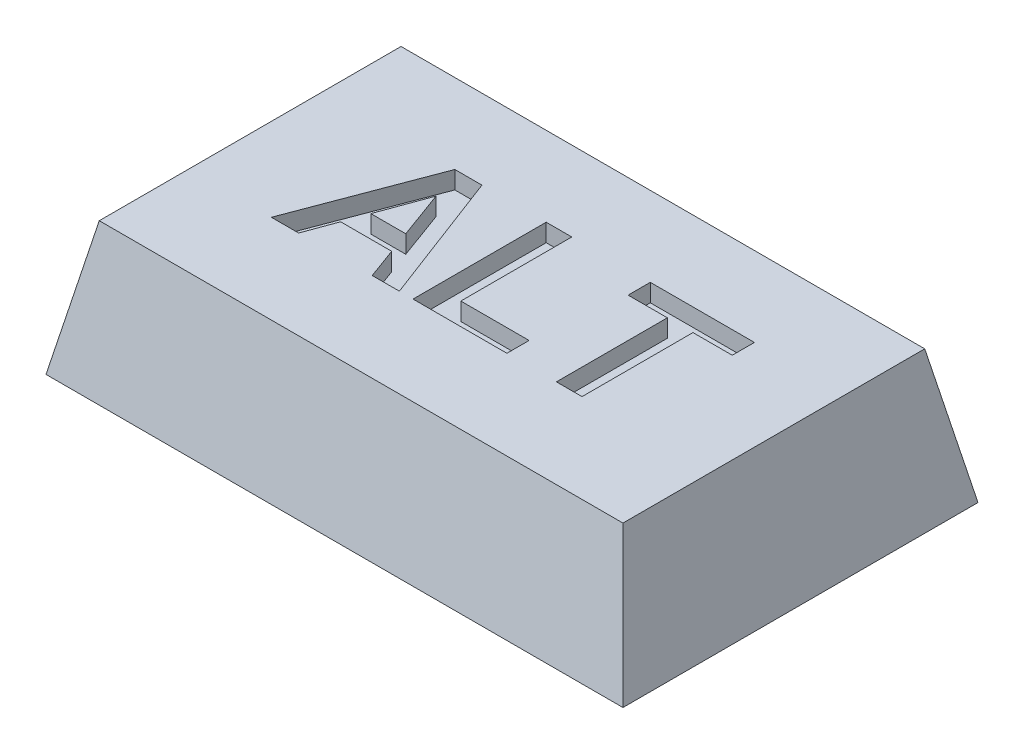
from build123d import *

# Parameters (mm, degrees)
SKETCH1_W               = 13
SKETCH1_H               = 8
BOSS_EXTRUDE1_DEPTH     = 3
CUT_EXTRUDE1_DEPTH      = 16.556349186
CUT_EXTRUDE1_DEPTH_BACK = 16.556349186
CUT_EXTRUDE2_DEPTH      = 16.556349186
CUT_EXTRUDE2_DEPTH_BACK = 16.556349186
SKETCH4_R               = 1.8
CUT_EXTRUDE3_DEPTH      = 0.8
SKETCH5_W               = 8
SKETCH5_H               = 1.1
BOSS_EXTRUDE2_DEPTH     = 2
FILLET1_R               = 4
CUT_EXTRUDE4_DEPTH      = 0.4


with BuildPart() as part:
    # Sketch1 → Boss-Extrude1 (new body)
    with BuildSketch(Plane(origin=(0, 0, 0), x_dir=(1, 0, 0), z_dir=(0, 1, 0))):
        with Locations((6.5, 4)):
            Rectangle(SKETCH1_W, SKETCH1_H)
    extrude(amount=BOSS_EXTRUDE1_DEPTH)

    # Sketch2 → Cut-Extrude1 (cut, two sides: drawn at the far end of the back side and taken through both)
    with BuildSketch(Plane.XY.offset(-CUT_EXTRUDE1_DEPTH_BACK)):
        Polygon((0, 0), (0.6, 3), (0, 3), align=None)
        Polygon((13, 0), (12.4, 3), (13, 3), align=None)
    extrude(amount=CUT_EXTRUDE1_DEPTH + CUT_EXTRUDE1_DEPTH_BACK, mode=Mode.SUBTRACT)

    # Sketch3 → Cut-Extrude2 (cut, two sides: drawn at the far end of the back side and taken through both)
    with BuildSketch(Plane(origin=(0, 0, 0), x_dir=(0, 0, -1), z_dir=(1, 0, 0)).offset(-CUT_EXTRUDE2_DEPTH_BACK)):
        Polygon((0, 0), (0.6, 3), (0, 3), align=None)
        Polygon((8, 3), (7.4, 3), (8, 0), align=None)
    extrude(amount=CUT_EXTRUDE2_DEPTH + CUT_EXTRUDE2_DEPTH_BACK, mode=Mode.SUBTRACT)

    # Sketch4 → Cut-Extrude3 (cut)
    with BuildSketch(Plane.XZ):
        with Locations(Location((6.50000125, -3.75, 0), (0, 0, 270))):
            Circle(SKETCH4_R)
    extrude(amount=-CUT_EXTRUDE3_DEPTH, mode=Mode.SUBTRACT)

    # Sketch5 → Boss-Extrude2 (add)
    with BuildSketch(Plane.XZ):
        with Locations((6.500011, -7.45)):
            Rectangle(SKETCH5_W, SKETCH5_H)
    extrude(amount=BOSS_EXTRUDE2_DEPTH)

    # Fillet1
    # the kernel refuses this fillet: 4 mm, written as the material it takes off along each edge
    with BuildSketch(Plane(origin=(10.500011, -2, -16.660254038), x_dir=(0, 1, 0), z_dir=(0, 0, 1)), Plane(origin=(2.500011, -2, 1.760254038), x_dir=(0, 1, 0), z_dir=(0, 0, -1))) as fillet1_piece_1:
        with BuildLine():
            CenterArc((4, 3.464101615), FILLET1_R, 180, 60)
            Line((0, 3.464101615), (-0.08, 3.464101615))
            Line((-0.08, 3.464101615), (-0.08, 0))
            Line((-0.08, 0), (0, -0.08))
            ThreePointArc((0, -0.08), (1, -0.08), (1.96, -0.069282032))
            Line((1.96, -0.069282032), (2, 0))
        make_face()
    extrude(amount=18.420508076, mode=Mode.SUBTRACT)

    # Sketch6 → Cut-Extrude4 (cut)
    # profile 1 of 3: a face of its own
    with BuildSketch(Plane(origin=(0, 3, 0), x_dir=(1, 0, 0), z_dir=(0, 1, 0))):
        Polygon((5.356583629, 2.605681315), (4.744804782, 2.605681315), (4.491799975, 3.297989008), (3.340357667, 3.297989008), (3.087352859, 2.605681315), (2.471968244, 2.605681315), (3.605982667, 5.605681315), (4.217160552, 5.605681315), align=None)
        Polygon((4.308506705, 3.797989008), (3.914275936, 4.874912084), (3.52124709, 3.797989008), align=None, mode=Mode.SUBTRACT)
    # profile 2 of 3: a face of its own
    with BuildSketch(Plane(origin=(0, 3, 0), x_dir=(1, 0, 0), z_dir=(0, 1, 0))):
        Polygon((5.664275936, 2.605681315), (5.664275936, 5.605681315), (6.241199013, 5.605681315), (6.241199013, 3.105681315), (7.779660552, 3.105681315), (7.779660552, 2.605681315), align=None)
    # profile 3 of 3: a face of its own
    with BuildSketch(Plane(origin=(0, 3, 0), x_dir=(1, 0, 0), z_dir=(0, 1, 0))):
        Polygon((8.895045167, 2.605681315), (8.895045167, 5.105681315), (8.010429782, 5.105681315), (8.010429782, 5.605681315), (10.356583629, 5.605681315), (10.356583629, 5.105681315), (9.471968244, 5.105681315), (9.471968244, 2.605681315), align=None)
    extrude(amount=-CUT_EXTRUDE4_DEPTH, mode=Mode.SUBTRACT)


solid = part.part
